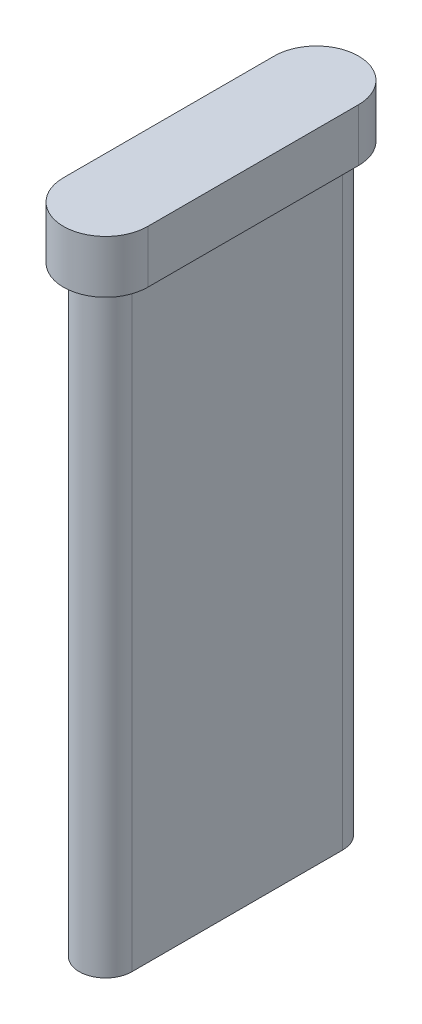
from build123d import *

# Parameters (mm, degrees)
BOSS_EXTRUDE1_DEPTH = 62
BOSS_EXTRUDE2_DEPTH = 5


with BuildPart() as part:
    # Sketch1 → Boss-Extrude1 (new body)
    with BuildSketch(Plane(origin=(0, 0, 0), x_dir=(1, 0, 0), z_dir=(0, 1, 0))):
        with BuildLine():
            Line((-2.5, -10), (-2.5, 10))
            ThreePointArc((-2.5, 10), (0, 12.5), (2.5, 10))
            Line((2.5, 10), (2.5, -10))
            ThreePointArc((2.5, -10), (0, -12.5), (-2.5, -10))
        make_face()
    extrude(amount=-BOSS_EXTRUDE1_DEPTH)

    # Sketch2 → Boss-Extrude2 (add)
    with BuildSketch(Plane(origin=(0, 0, 0), x_dir=(1, 0, 0), z_dir=(0, 1, 0))):
        with BuildLine():
            Line((4, -10), (4, 10))
            ThreePointArc((4, 10), (0, 14), (-4, 10))
            Line((-4, 10), (-4, -10))
            ThreePointArc((-4, -10), (0, -14), (4, -10))
        make_face()
    extrude(amount=-BOSS_EXTRUDE2_DEPTH)


solid = part.part
